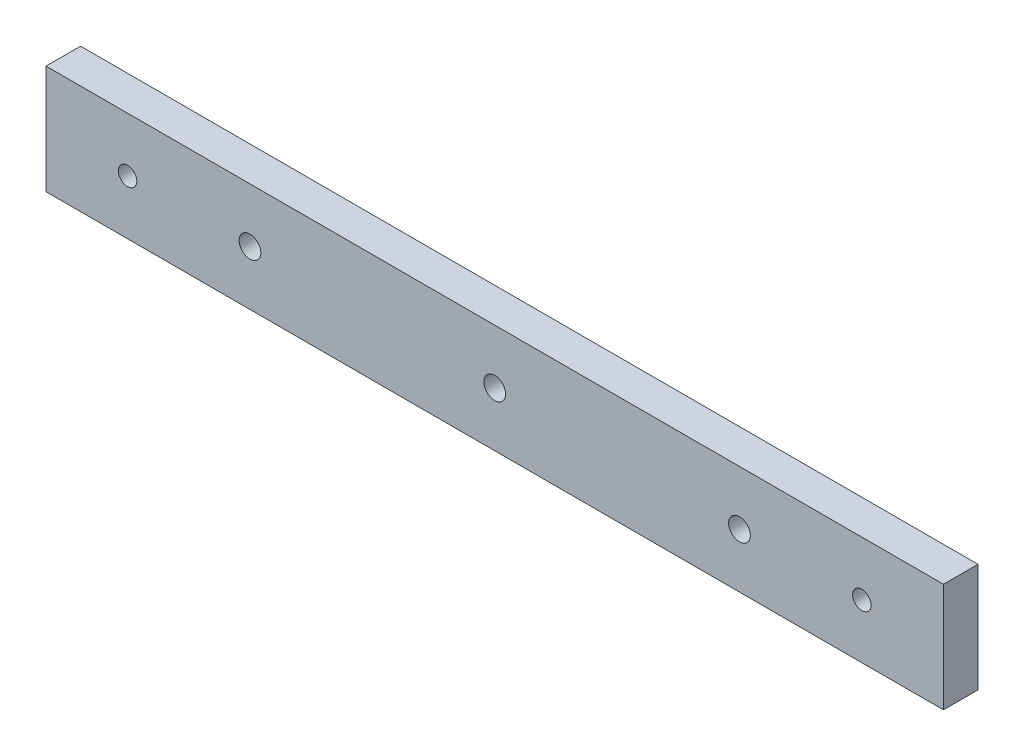
from build123d import *

# Parameters (mm, degrees)
SKETCH1_W           = 165
SKETCH1_H           = 20
SKETCH1_R           = 1.7
BOSS_EXTRUDE1_DEPTH = 6.35
CUT_EXTRUDE2_DEPTH  = 3.35
SKETCH4_R           = 2
CUT_EXTRUDE3_DEPTH  = 3


with BuildPart() as part:
    # Sketch1 → Boss-Extrude1 (new body)
    with BuildSketch(Plane(origin=(0, 0, 0), x_dir=(-1, 0, 0), z_dir=(0, 0, 1))):
        with Locations((52.952306935, 12.575384489)):
            Rectangle(SKETCH1_W, SKETCH1_H)
        with Locations((-14.547693065, 12.575384489)):
            Circle(SKETCH1_R, mode=Mode.SUBTRACT)
        with Locations((120.452306935, 12.575384489)):
            Circle(SKETCH1_R, mode=Mode.SUBTRACT)
    extrude(amount=BOSS_EXTRUDE1_DEPTH)

    # Sketch3 → Cut-Extrude2 (cut)
    with BuildSketch(Plane(origin=(0, 0, 0), x_dir=(-1, 0, 0), z_dir=(0, 0, -1))):
        with BuildLine():
            Line((56.502306935, -16.125384489), (49.402306935, -16.125384489))
            ThreePointArc((49.402306935, -16.125384489), (45.852306935, -12.575384489), (49.402306935, -9.025384489))
            Line((49.402306935, -9.025384489), (56.502306935, -9.025384489))
            ThreePointArc((56.502306935, -9.025384489), (60.052306935, -12.575384489), (56.502306935, -16.125384489))
        make_face()
        with BuildLine():
            Line((101.502306935, -16.125384489), (94.402306935, -16.125384489))
            ThreePointArc((94.402306935, -16.125384489), (90.852306935, -12.575384489), (94.402306935, -9.025384489))
            Line((94.402306935, -9.025384489), (101.502306935, -9.025384489))
            ThreePointArc((101.502306935, -9.025384489), (105.052306935, -12.575384489), (101.502306935, -16.125384489))
        make_face()
        with BuildLine():
            Line((11.502306935, -16.125384489), (4.402306935, -16.125384489))
            ThreePointArc((4.402306935, -16.125384489), (0.852306935, -12.575384489), (4.402306935, -9.025384489))
            Line((4.402306935, -9.025384489), (11.502306935, -9.025384489))
            ThreePointArc((11.502306935, -9.025384489), (15.052306935, -12.575384489), (11.502306935, -16.125384489))
        make_face()
    extrude(amount=-CUT_EXTRUDE2_DEPTH, mode=Mode.SUBTRACT)

    # Sketch4 → Cut-Extrude3 (cut)
    with BuildSketch(Plane(origin=(0, 0, 3.35), x_dir=(-1, 0, 0), z_dir=(0, 0, -1))):
        with Locations((7.952306935, -12.575384489)):
            Circle(SKETCH4_R)
        with Locations((97.952306935, -12.575384489)):
            Circle(SKETCH4_R)
        with Locations((52.952306935, -12.575384489)):
            Circle(SKETCH4_R)
    extrude(amount=-CUT_EXTRUDE3_DEPTH, mode=Mode.SUBTRACT)


solid = part.part
